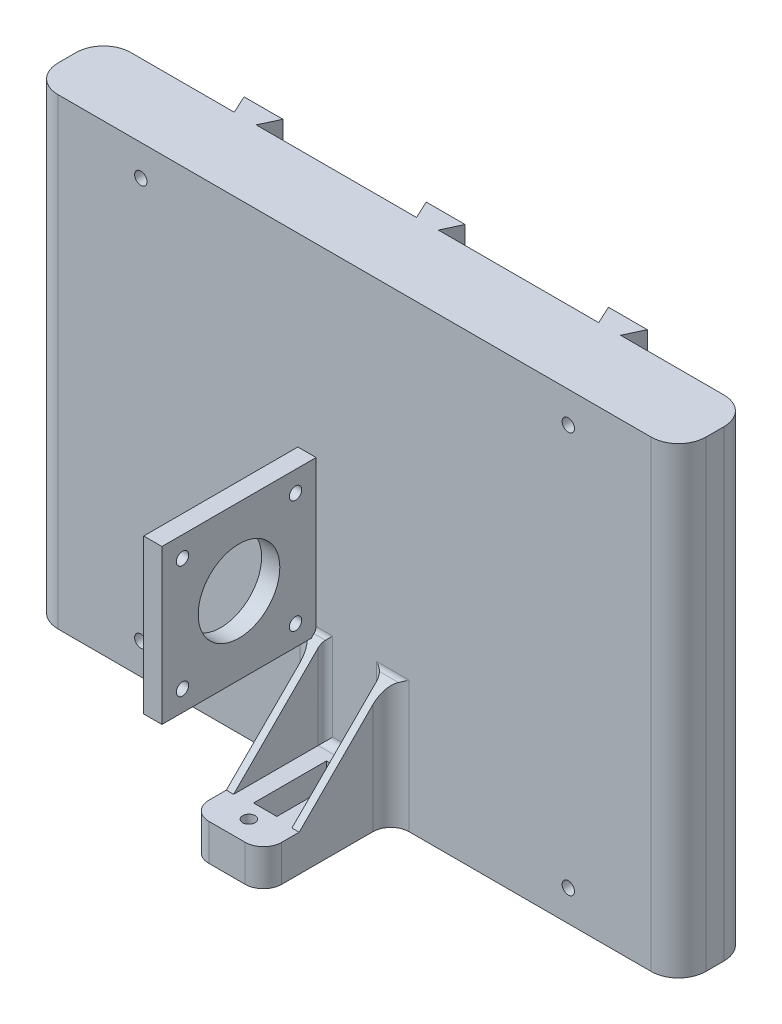
from build123d import *

# Parameters (mm, degrees)
BOSS_EXTRUDE1_DEPTH     = 127
SKETCH3_W               = 5
SKETCH3_H               = 42.3
BOSS_EXTRUDE2_DEPTH     = 42.3
SKETCH4_R               = 1.7
CUT_EXTRUDE1_DEPTH      = 5
CUT_EXTRUDE7_DEPTH      = 161.690696682
CUT_EXTRUDE7_DEPTH_BACK = 161.690696682
SKETCH5_R               = 1.7
SKETCH8_R               = 3.2
CUT_EXTRUDE8_DEPTH      = 2
SKETCH10_W              = 20
SKETCH10_H              = 10
BOSS_EXTRUDE3_DEPTH     = 35
FILLET3_R               = 5
SKETCH12_R              = 1.7
CUT_EXTRUDE9_DEPTH      = 35
RIB47_START             = -2
RIB47_DEPTH             = 2
FILLET7_R               = 5
FILLET8_R               = 2
SKETCH18_W              = 6.4
SKETCH18_H              = 20
CUT_EXTRUDE10_DEPTH     = 9
SKETCH19_W              = 5
SKETCH19_H              = 18
CUT_EXTRUDE11_DEPTH     = 4


# Read off the part's stored shape, not the designer's step: Rib47
with BuildPart() as part:
    # Sketch2 → Boss-Extrude1 (new body)
    with BuildSketch(Plane(origin=(0, 0, 0), x_dir=(1, 0, 0), z_dir=(0, 1, 0))):
        with BuildLine():
            Line((-5.331538291, 0), (-3, -5))
            Line((-3, -5), (-47, -5))
            Line((-47, -5), (-44.668461709, 0))
            Line((-44.668461709, 0), (-55.331538291, 0))
            Line((-55.331538291, 0), (-53, -5))
            Line((-53, -5), (-81.4, -5))
            ThreePointArc((-81.4, -5), (-86.703300859, -7.196699141), (-88.9, -12.5))
            Line((-88.9, -12.5), (-88.9, -17.5))
            ThreePointArc((-88.9, -17.5), (-86.703300859, -22.803300859), (-81.4, -25))
            Line((-81.4, -25), (81.4, -25))
            ThreePointArc((81.4, -25), (86.703300859, -22.803300859), (88.9, -17.5))
            Line((88.9, -17.5), (88.9, -12.5))
            ThreePointArc((88.9, -12.5), (86.703300859, -7.196699141), (81.4, -5))
            Line((81.4, -5), (53, -5))
            Line((53, -5), (55.331538291, 0))
            Line((55.331538291, 0), (44.668461709, 0))
            Line((44.668461709, 0), (47, -5))
            Line((47, -5), (3, -5))
            Line((3, -5), (5.331538291, 0))
            Line((5.331538291, 0), (-5.331538291, 0))
        make_face()
    extrude(amount=BOSS_EXTRUDE1_DEPTH)

    # Sketch3 → Boss-Extrude2 (add)
    with BuildSketch(Plane.XY.offset(25)):
        with Locations((-13.06, 55.018873206)):
            Rectangle(SKETCH3_W, SKETCH3_H)
    extrude(amount=BOSS_EXTRUDE2_DEPTH)

    # Sketch4 → Cut-Extrude1 (cut)
    with BuildSketch(Plane(origin=(-10.56, 0, 0), x_dir=(0, 0, -1), z_dir=(1, 0, 0))):
        with BuildLine():
            ThreePointArc((-34.95, 55.018873206), (-46.15, 66.218873206), (-57.35, 55.018873206))
            Line((-57.35, 55.018873206), (-34.95, 55.018873206))
        make_face()
        with BuildLine():
            Line((-34.95, 55.018873206), (-57.35, 55.018873206))
            ThreePointArc((-57.35, 55.018873206), (-46.15, 43.818873206), (-34.95, 55.018873206))
        make_face()
        with Locations((-61.65, 70.518873206)):
            Circle(SKETCH4_R)
        with Locations((-30.65, 70.518873206)):
            Circle(SKETCH4_R)
        with Locations((-30.65, 39.518873206)):
            Circle(SKETCH4_R)
        with Locations((-61.65, 39.518873206)):
            Circle(SKETCH4_R)
    extrude(amount=-CUT_EXTRUDE1_DEPTH, mode=Mode.SUBTRACT)

    # Sketch5 → Cut-Extrude7 (cut, two sides: drawn at the far end of the back side and taken through both)
    with BuildSketch(Plane.XY.offset(25).offset(-CUT_EXTRUDE7_DEPTH_BACK)):
        with Locations(Location((-58.65, 118.5, 0), (0, 0, 180))):
            Circle(SKETCH5_R)
        with Locations((58.65, 118.5)):
            Circle(SKETCH5_R)
        with Locations((58.65, 8.5)):
            Circle(SKETCH5_R)
        with Locations(Location((-58.65, 8.5, 0), (0, 0, 180))):
            Circle(SKETCH5_R)
    extrude(amount=CUT_EXTRUDE7_DEPTH + CUT_EXTRUDE7_DEPTH_BACK, mode=Mode.SUBTRACT)

    # Sketch8 → Cut-Extrude8 (cut)
    with BuildSketch(Plane(origin=(0, 0, 5), x_dir=(-1, 0, 0), z_dir=(0, 0, -1))):
        with Locations((-58.65, 118.5)):
            Circle(SKETCH8_R)
        with Locations((-58.65, 8.5)):
            Circle(SKETCH8_R)
        with Locations((58.65, 118.5)):
            Circle(SKETCH8_R)
        with Locations((58.65, 8.5)):
            Circle(SKETCH8_R)
    extrude(amount=-CUT_EXTRUDE8_DEPTH, mode=Mode.SUBTRACT)

    # Sketch10 → Boss-Extrude3 (add)
    with BuildSketch(Plane.XY.offset(25)):
        with Locations((0, 5)):
            Rectangle(SKETCH10_W, SKETCH10_H)
    extrude(amount=BOSS_EXTRUDE3_DEPTH)

    # Fillet3
    fillet3_edges = [part.edges().sort_by_distance(p)[0] for p in [
        (-10, 5, 60),
        (10, 5, 60),
    ]]
    fillet(fillet3_edges, radius=FILLET3_R)

    # Sketch12 → Cut-Extrude9 (cut)
    with BuildSketch(Plane(origin=(0, 10, 0), x_dir=(1, 0, 0), z_dir=(0, 1, 0))):
        with Locations(Location((0, -54, 0), (0, 0, 270))):
            Circle(SKETCH12_R)
    extrude(amount=-CUT_EXTRUDE9_DEPTH, mode=Mode.SUBTRACT)

    # Rib47 outline → Rib47 (add)
    with BuildSketch(Plane(origin=(10, 0, 0), x_dir=(0, 0, -1), z_dir=(1, 0, 0)).offset(RIB47_START)):
        Polygon((-25, 35.191123447), (-50.191123447, 10), (-25, 10), align=None)
    rib47 = extrude(amount=RIB47_DEPTH)

    # Mirror1: Rib47 across plane
    add(rib47.mirror(Plane(origin=(0, 0, 0), x_dir=(0, 0, 1), z_dir=(1, 0, 0))))

    # Fillet7
    # the kernel refuses this fillet: 5 mm, written as the material it adds along each edge
    with BuildSketch(Plane(origin=(-10, 47.691123447, 25), x_dir=(-1, 0, 0), z_dir=(0, -1, 0))) as fillet7_piece_1_section:
        with BuildLine():
            CenterArc((FILLET7_R, -FILLET7_R), FILLET7_R, 90, 90)
            Line((0, -FILLET7_R), (0, 0))
            Line((0, 0), (FILLET7_R, 0))
        make_face()
    fillet7_piece_1 = extrude(amount=47.691123447, mode=Mode.PRIVATE)
    fillet7_piece_1 = split(fillet7_piece_1, bisect_by=Plane(origin=(-11.152129269, 25.569946894, 34.621176553), z_dir=(0, -0.7071067811865476, -0.7071067811865476)), keep=Keep.TOP, mode=Mode.PRIVATE)
    add(fillet7_piece_1)
    with BuildSketch(Plane(origin=(10, 47.691123447, 25), x_dir=(0, 0, 1), z_dir=(0, -1, 0))) as fillet7_piece_2_section:
        with BuildLine():
            CenterArc((FILLET7_R, -FILLET7_R), FILLET7_R, 90, 90)
            Line((0, -FILLET7_R), (0, 0))
            Line((0, 0), (FILLET7_R, 0))
        make_face()
    fillet7_piece_2 = extrude(amount=47.691123447, mode=Mode.PRIVATE)
    fillet7_piece_2 = split(fillet7_piece_2, bisect_by=Plane(origin=(11.152129269, 25.569946894, 34.621176553), z_dir=(0, -0.7071067811865476, -0.7071067811865476)), keep=Keep.TOP, mode=Mode.PRIVATE)
    add(fillet7_piece_2)

    # Fillet8
    fillet8_edges = [part.edges().sort_by_distance(p)[0] for p in [
        (0, 10, 25),
        (8, 22.595561724, 25),
        (11.5, 35.191123447, 25),
        (-9.28, 35.191123447, 25),
        (-8, 22.595561724, 25),
    ]]
    fillet(fillet8_edges, radius=FILLET8_R)

    # Sketch18 → Cut-Extrude10 (cut)
    with BuildSketch(Plane(origin=(0, 10, 0), x_dir=(1, 0, 0), z_dir=(0, 1, 0))):
        with Locations((0, -39.517084206)):
            Rectangle(SKETCH18_W, SKETCH18_H)
    extrude(amount=-CUT_EXTRUDE10_DEPTH, mode=Mode.SUBTRACT)

    # Sketch19 → Cut-Extrude11 (cut)
    with BuildSketch(Plane(origin=(0, 1, 0), x_dir=(1, 0, 0), z_dir=(0, 1, 0))):
        with Locations((0, -40.017084206)):
            Rectangle(SKETCH19_W, SKETCH19_H)
    extrude(amount=-CUT_EXTRUDE11_DEPTH, mode=Mode.SUBTRACT)


solid = part.part
